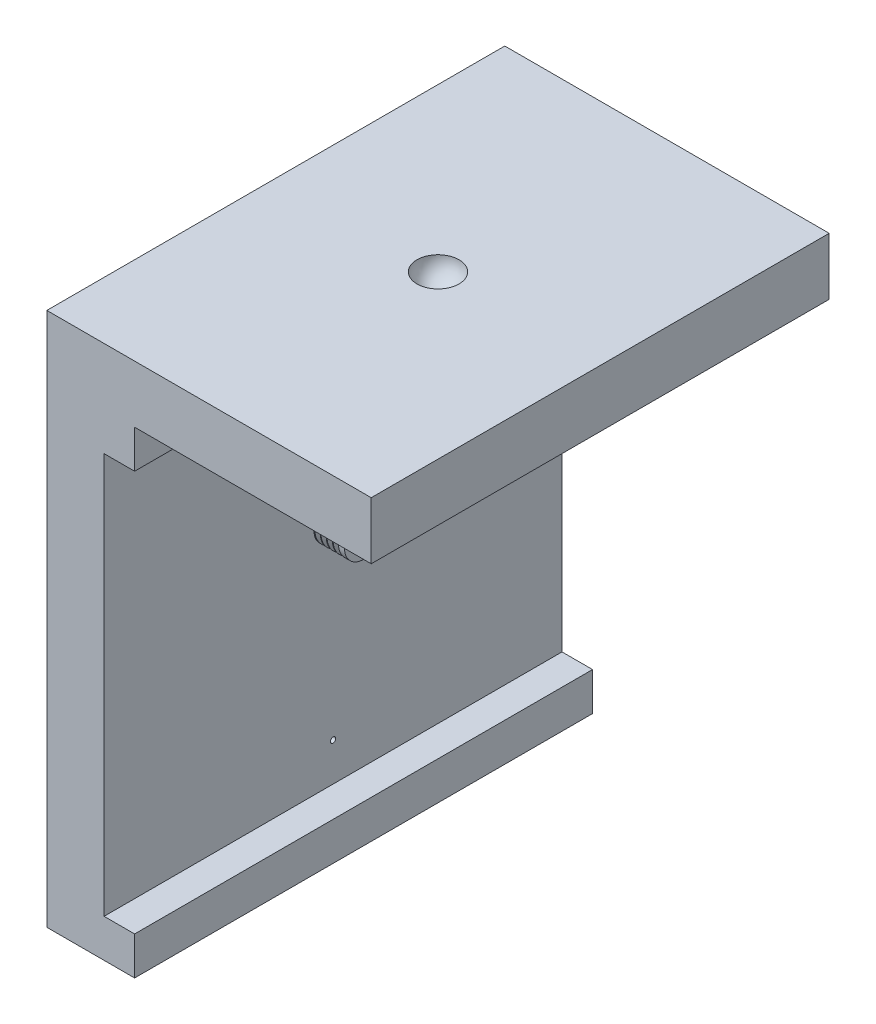
from build123d import *

# Parameters (mm, degrees)
BOSS_EXTRUDE1_DEPTH = 60
SKETCH3_R           = 0.35
CUT_EXTRUDE1_DEPTH  = 102.519702521
SKETCH5_W           = 60
SKETCH5_H           = 5
BOSS_EXTRUDE2_DEPTH = 4
SKETCH6_R           = 2.5
BOSS_EXTRUDE3_DEPTH = 4
THREAD1_PITCH       = 0.79375


with BuildPart() as part:
    # Sketch1 → Boss-Extrude1 (new body)
    with BuildSketch(Plane.XY):
        Polygon((0, 0), (0, -70), (7.5, -70), (7.5, -7.5), (42.5, -7.5), (42.5, 0), align=None)
    extrude(amount=BOSS_EXTRUDE1_DEPTH)

    # Sketch3 → Cut-Extrude1 (cut, through all)
    with BuildSketch(Plane.ZY):
        with Locations(Location((30, -60, 0), (0, 0, 270))):
            Circle(SKETCH3_R)
    extrude(amount=-CUT_EXTRUDE1_DEPTH, mode=Mode.SUBTRACT)

    # Sketch5 → Boss-Extrude2 (add)
    with BuildSketch(Plane(origin=(7.5, 0, 0), x_dir=(0, 0, -1), z_dir=(1, 0, 0))):
        with Locations((-30, -67.5)):
            Rectangle(SKETCH5_W, SKETCH5_H)
        with Locations((-30, -10)):
            Rectangle(SKETCH5_W, SKETCH5_H)
    extrude(amount=BOSS_EXTRUDE2_DEPTH)

    # Sketch6 → Boss-Extrude3 (add)
    with BuildSketch(Plane(origin=(7.5, 0, 0), x_dir=(0, 0, -1), z_dir=(1, 0, 0))):
        with Locations(Location((-30, -35, 0), (0, 0, 270))):
            Circle(SKETCH6_R)
    extrude(amount=BOSS_EXTRUDE3_DEPTH)

    # Thread1: the profile of Thread Profile1 profile screwed along a right-hand helix of 6.299213 turns, 8 arcs to a turn; built about Z, then put on its axis
    thread1_z = Axis((0, 0, 0), (0, 0, 1))
    thread1_corners = [(2.5003, 0, -0.000173205), (2.5003, 0, 0.694704453), (2.070370212, 0, 0.446484374), (2.070370212, 0, 0.248046874)]
    with BuildLine(mode=Mode.PRIVATE) as thread1_profile:
        Line(thread1_corners[0], thread1_corners[1])
        Line(thread1_corners[1], thread1_corners[2])
        Line(thread1_corners[2], thread1_corners[3])
        Line(thread1_corners[3], thread1_corners[0])
    thread1_cap = Face(thread1_profile.wire())
    thread1_turn_angles = [0, 22.5, 45, 67.5, 90, 112.5, 135, 157.5, 180, 202.5, 225, 247.5, 270, 292.5, 315, 337.5, 360]
    thread1_turn_weights = [1, 0.9238795325112867, 1, 0.9238795325112867, 1, 0.9238795325112867, 1, 0.9238795325112867, 1, 0.9238795325112867, 1, 0.9238795325112867, 1, 0.9238795325112867, 1, 0.9238795325112867, 1]
    thread1_turn_rails = [Edge.make_bspline([Vector(p[0], p[1], 0).rotate(thread1_z, thread1_turn_angles[k]) / thread1_turn_weights[k] + Vector(0, 0, p[2] + THREAD1_PITCH * thread1_turn_angles[k] / 360) for k in range(17)], [0, 0, 0, 1, 1, 2, 2, 3, 3, 4, 4, 5, 5, 6, 6, 7, 7, 8, 8, 8], 2, thread1_turn_weights) for p in thread1_corners]
    thread1_turn_sides = [Face.make_surface_from_curves(thread1_turn_rails[p[0]], thread1_turn_rails[p[1]]) for p in [(0, 1), (1, 2), (2, 3), (3, 0)]]
    thread1_last_angles = [2160, 2182.5, 2205, 2227.5, 2250, 2258.858267717, 2267.716535433]
    thread1_last_weights = [1, 0.9238795325112867, 1, 0.9238795325112867, 1, 0.988072289441528, 1]
    thread1_last_rails = [Edge.make_bspline([Vector(p[0], p[1], 0).rotate(thread1_z, thread1_last_angles[k]) / thread1_last_weights[k] + Vector(0, 0, p[2] + THREAD1_PITCH * thread1_last_angles[k] / 360) for k in range(7)], [0, 0, 0, 1, 1, 2, 2, 3, 3, 3], 2, thread1_last_weights) for p in thread1_corners]
    thread1_last_sides = [Face.make_surface_from_curves(thread1_last_rails[p[0]], thread1_last_rails[p[1]]) for p in [(0, 1), (1, 2), (2, 3), (3, 0)]]
    thread1 = Plane(origin=(11.5, -35, 30), x_dir=(0, 0, 1), z_dir=(-1, 0, 0)) * Solid(Shell([*[p.moved(Location((0, 0, THREAD1_PITCH * i))) for i in range(6) for p in thread1_turn_sides], *thread1_last_sides, thread1_cap, thread1_cap.rotate(thread1_z, 2267.716535433).moved(Location((0, 0, THREAD1_PITCH * 2267.716535433 / 360)))]))
    add(thread1, mode=Mode.SUBTRACT)

    # Sketch7 → Cut-Revolve1 (revolve, cut)
    with BuildSketch(Plane(origin=(0, 0, 0), x_dir=(1, 0, 0), z_dir=(0, 1, 0))):
        with BuildLine():
            Line((18.5, -30), (24, -30))
            ThreePointArc((24, -30), (21.25, -32.75), (18.5, -30))
        make_face()
    revolve(axis=Axis((18.5, 0, 30), (1, 0, 0)), mode=Mode.SUBTRACT)


solid = part.part
